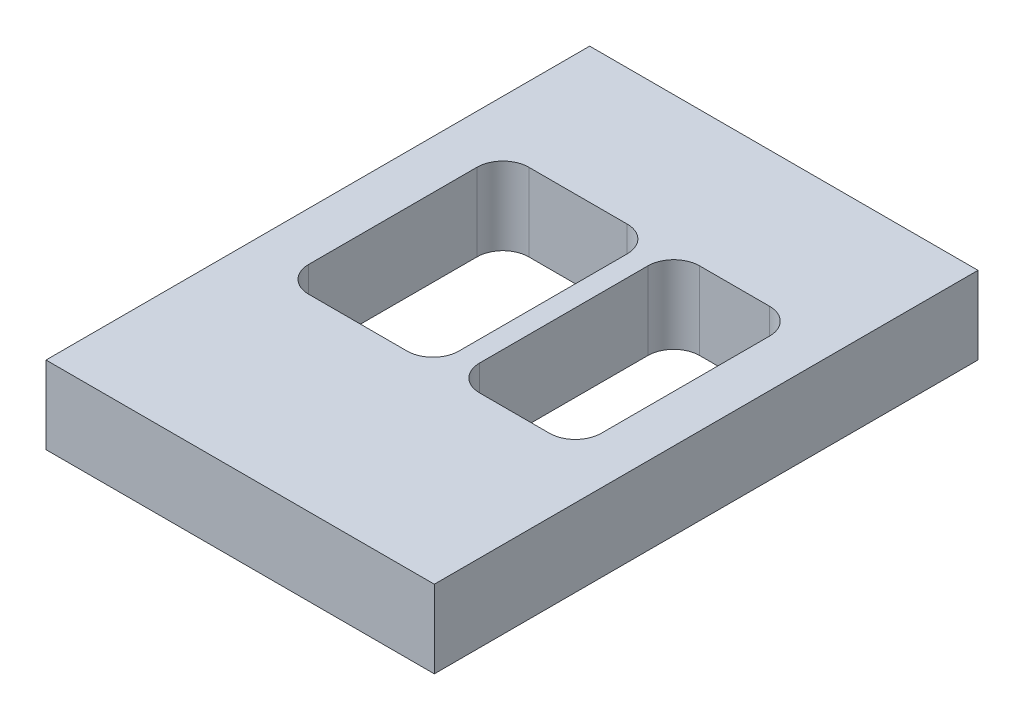
from build123d import *

# Parameters (mm, degrees)
SKETCH1_W           = 150
SKETCH1_H           = 210
BOSS_EXTRUDE1_DEPTH = 30
CUT_EXTRUDE1_REACH  = 134.476
SKETCH3_W           = 58
SKETCH3_H           = 85
SKETCH3_W_2         = 47
FILLET1_R           = 10


with BuildPart() as part:
    # Sketch1 → Boss-Extrude1 (new body)
    with BuildSketch(Plane(origin=(0, 0, 0), x_dir=(1, 0, 0), z_dir=(0, 1, 0))):
        Rectangle(SKETCH1_W, SKETCH1_H)
    extrude(amount=-BOSS_EXTRUDE1_DEPTH)

    # Sketch3 → Cut-Extrude1 (cut, up to next)
    with BuildSketch(Plane(origin=(0, 0, 0), x_dir=(1, 0, 0), z_dir=(0, 1, 0)), mode=Mode.PRIVATE) as cut_extrude1_sk1:
        with Locations((-27.25, 10.23)):
            Rectangle(SKETCH3_W, SKETCH3_H)
    cut_extrude1_tool1 = extrude(cut_extrude1_sk1.sketch, amount=-CUT_EXTRUDE1_REACH, mode=Mode.PRIVATE) & part.part
    # Sketch3 → Cut-Extrude1 (cut, up to next)
    with BuildSketch(Plane(origin=(0, 0, 0), x_dir=(1, 0, 0), z_dir=(0, 1, 0)), mode=Mode.PRIVATE) as cut_extrude1_sk2:
        with Locations((33.25, 10.23)):
            Rectangle(SKETCH3_W_2, SKETCH3_H)
    cut_extrude1_tool2 = extrude(cut_extrude1_sk2.sketch, amount=-CUT_EXTRUDE1_REACH, mode=Mode.PRIVATE) & part.part
    add(cut_extrude1_tool1.solids().sort_by_distance((-27.25, 0, -10.23))[0], mode=Mode.SUBTRACT)
    add(cut_extrude1_tool2.solids().sort_by_distance((33.25, 0, -10.23))[0], mode=Mode.SUBTRACT)

    # Fillet1
    fillet1_edges = [part.edges().sort_by_distance(p)[0] for p in [
        (9.75, -15, -52.73),
        (56.75, -15, 32.27),
        (56.75, -15, -52.73),
        (9.75, -15, 32.27),
        (-56.25, -15, 32.27),
        (1.75, -15, 32.27),
        (1.75, -15, -52.73),
        (-56.25, -15, -52.73),
    ]]
    fillet(fillet1_edges, radius=FILLET1_R)


solid = part.part
